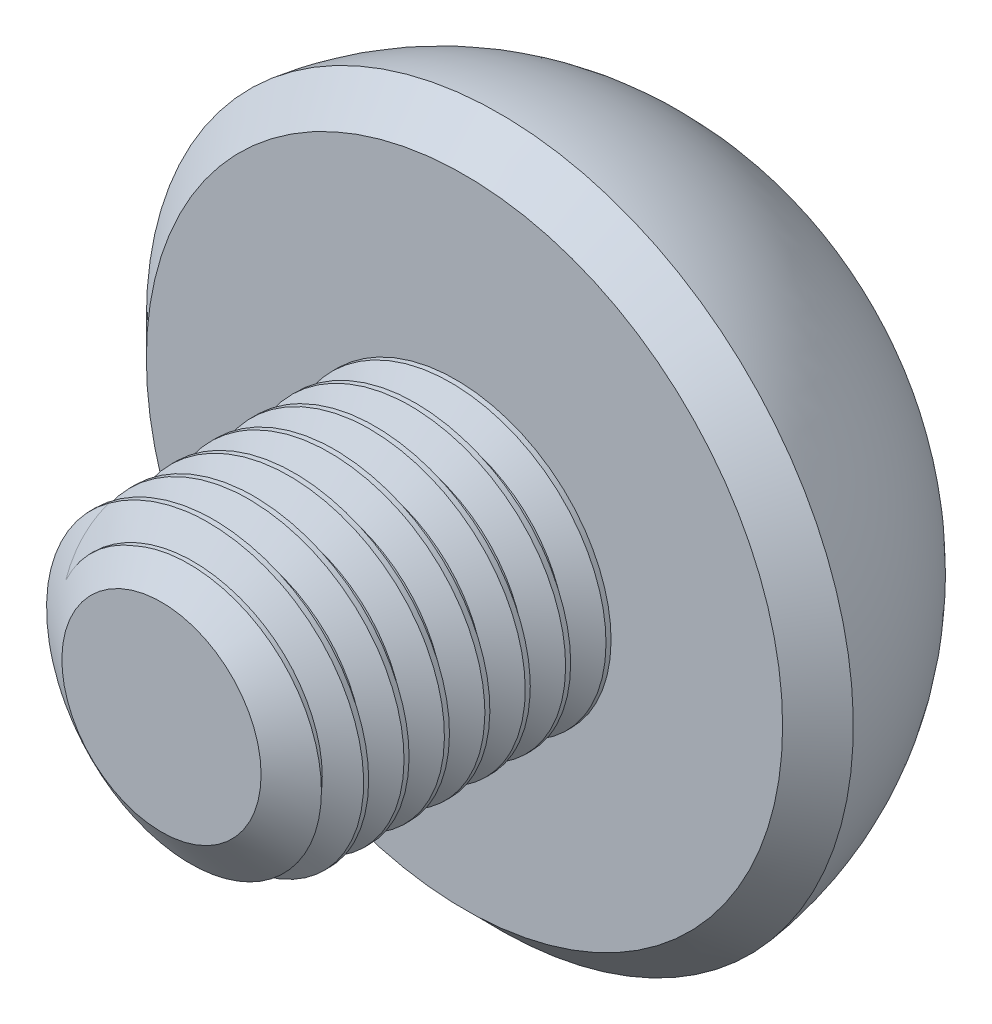
from build123d import *

# Parameters (mm, degrees)
SKETCH1_R             = 1.5
EXTRUDE1_DEPTH        = 3
CUT_SWEEP1_PITCH      = 0.4
SKETCH6_R             = 3.5
EXTRUDE2_DEPTH        = 3
CHAMFER1_SIZE         = 0.35
REDONDEO1_R           = 3
CROQUIS1_W            = 0.6
CROQUIS1_H            = 2.2
CROQUIS1_W_2          = 2.2
CROQUIS1_H_2          = 0.6
CORTAR_EXTRUIR1_DEPTH = 1


with BuildPart() as part:
    # Sketch1 → Extrude1 (new body)
    with BuildSketch(Plane.XY):
        Circle(SKETCH1_R)
    extrude(amount=-EXTRUDE1_DEPTH)

    # Cut-Sweep1: the profile of Sketch3 profile screwed along a right-hand helix of 8.5 turns, 6 arcs to a turn; built about Z, then put on its axis
    cut_sweep1_z = Axis((0, 0, 0), (0, 0, 1))
    cut_sweep1_corners = [(1.5003, 0, -0.350173205), (1.240192379, 0, -0.2), (1.240192379, 0, -0.15), (1.5003, 0, 0.000173205)]
    with BuildLine(mode=Mode.PRIVATE) as cut_sweep1_profile:
        Line(cut_sweep1_corners[0], cut_sweep1_corners[1])
        Line(cut_sweep1_corners[1], cut_sweep1_corners[2])
        Line(cut_sweep1_corners[2], cut_sweep1_corners[3])
        Line(cut_sweep1_corners[3], cut_sweep1_corners[0])
    cut_sweep1_cap = Face(cut_sweep1_profile.wire())
    cut_sweep1_turn_angles = [0, 30, 60, 90, 120, 150, 180, 210, 240, 270, 300, 330, 360]
    cut_sweep1_turn_weights = [1, 0.8660254037844387, 1, 0.8660254037844387, 1, 0.8660254037844387, 1, 0.8660254037844387, 1, 0.8660254037844387, 1, 0.8660254037844387, 1]
    cut_sweep1_turn_rails = [Edge.make_bspline([Vector(p[0], p[1], 0).rotate(cut_sweep1_z, cut_sweep1_turn_angles[k]) / cut_sweep1_turn_weights[k] + Vector(0, 0, p[2] + CUT_SWEEP1_PITCH * cut_sweep1_turn_angles[k] / 360) for k in range(13)], [0, 0, 0, 1, 1, 2, 2, 3, 3, 4, 4, 5, 5, 6, 6, 6], 2, cut_sweep1_turn_weights) for p in cut_sweep1_corners]
    cut_sweep1_turn_sides = [Face.make_surface_from_curves(cut_sweep1_turn_rails[p[0]], cut_sweep1_turn_rails[p[1]]) for p in [(0, 1), (1, 2), (2, 3), (3, 0)]]
    cut_sweep1_last_angles = [2880, 2910, 2940, 2970, 3000, 3030, 3060]
    cut_sweep1_last_weights = [1, 0.8660254037844387, 1, 0.8660254037844387, 1, 0.8660254037844446, 1]
    cut_sweep1_last_rails = [Edge.make_bspline([Vector(p[0], p[1], 0).rotate(cut_sweep1_z, cut_sweep1_last_angles[k]) / cut_sweep1_last_weights[k] + Vector(0, 0, p[2] + CUT_SWEEP1_PITCH * cut_sweep1_last_angles[k] / 360) for k in range(7)], [0, 0, 0, 1, 1, 2, 2, 3, 3, 3], 2, cut_sweep1_last_weights) for p in cut_sweep1_corners]
    cut_sweep1_last_sides = [Face.make_surface_from_curves(cut_sweep1_last_rails[p[0]], cut_sweep1_last_rails[p[1]]) for p in [(0, 1), (1, 2), (2, 3), (3, 0)]]
    cut_sweep1 = Plane(origin=(0, 0, 0), x_dir=(0, 1, 0), z_dir=(0, 0, -1)) * Solid(Shell([*[p.moved(Location((0, 0, CUT_SWEEP1_PITCH * i))) for i in range(8) for p in cut_sweep1_turn_sides], *cut_sweep1_last_sides, cut_sweep1_cap, cut_sweep1_cap.rotate(cut_sweep1_z, 3060).moved(Location((0, 0, CUT_SWEEP1_PITCH * 3060 / 360)))]))
    add(cut_sweep1, mode=Mode.SUBTRACT)

    # Sketch4 → Cut-Revolve1 (revolve, cut)
    with BuildSketch(Plane(origin=(0, 0, 0), x_dir=(0, 0, -1), z_dir=(1, 0, 0)), mode=Mode.PRIVATE) as cut_revolve1_sk:
        Polygon((0.35977197, 1.5), (0, 0.986192379), (0, 1.5), align=None)
    revolve(cut_revolve1_sk.sketch.rotate(Axis((0, 0, 0), (0, 0, -1)), 278.428757719), axis=Axis((0, 0, 0), (0, 0, -1)), mode=Mode.SUBTRACT)

    # Sketch6 → Extrude2 (add)
    with BuildSketch(Plane(origin=(0, 0, -3), x_dir=(-1, 0, 0), z_dir=(0, 0, -1))):
        Circle(SKETCH6_R)
    extrude(amount=EXTRUDE2_DEPTH)

    # Chamfer1
    chamfer1_edges = [part.edges().sort_by_distance(p)[0] for p in [
        (3.5, 0, -3),
    ]]
    chamfer(chamfer1_edges, length=CHAMFER1_SIZE)

    # Redondeo1
    # the kernel refuses this fillet: 3 mm, written as the material it takes off along each edge
    with BuildSketch(Plane(origin=(0, 0, -6), x_dir=(-1, 0, 0), z_dir=(0, -1, 0))) as redondeo1_piece_1:
        with BuildLine():
            CenterArc((0.520486617, -3), REDONDEO1_R, 6.699765178, 83.300234822)
            Line((0.520486617, 0), (0.520486617, 0.06))
            Line((0.520486617, 0.06), (3.5, 0.06))
            Line((3.5, 0.06), (3.56, 0))
            ThreePointArc((3.56, 0), (3.56, -1.325), (3.559590268, -2.643))
            Line((3.559590268, -2.643), (3.5, -2.65))
        make_face()
    revolve(axis=Axis((0, 0, -6), (0, 0, -1)), mode=Mode.SUBTRACT)

    # Croquis1 → Cortar-Extruir1 (cut)
    with BuildSketch(Plane(origin=(0, 0, -6), x_dir=(-1, 0, 0), z_dir=(0, 0, -1))):
        with Locations((0, -1.4)):
            Rectangle(CROQUIS1_W, CROQUIS1_H)
        with Locations((-1.4, 0)):
            Rectangle(CROQUIS1_W_2, CROQUIS1_H_2)
        with Locations((0, 1.4)):
            Rectangle(CROQUIS1_W, CROQUIS1_H)
        Rectangle(CROQUIS1_W, CROQUIS1_H_2)
        with Locations((1.4, 0)):
            Rectangle(CROQUIS1_W_2, CROQUIS1_H_2)
    extrude(amount=-CORTAR_EXTRUIR1_DEPTH, mode=Mode.SUBTRACT)


solid = part.part
